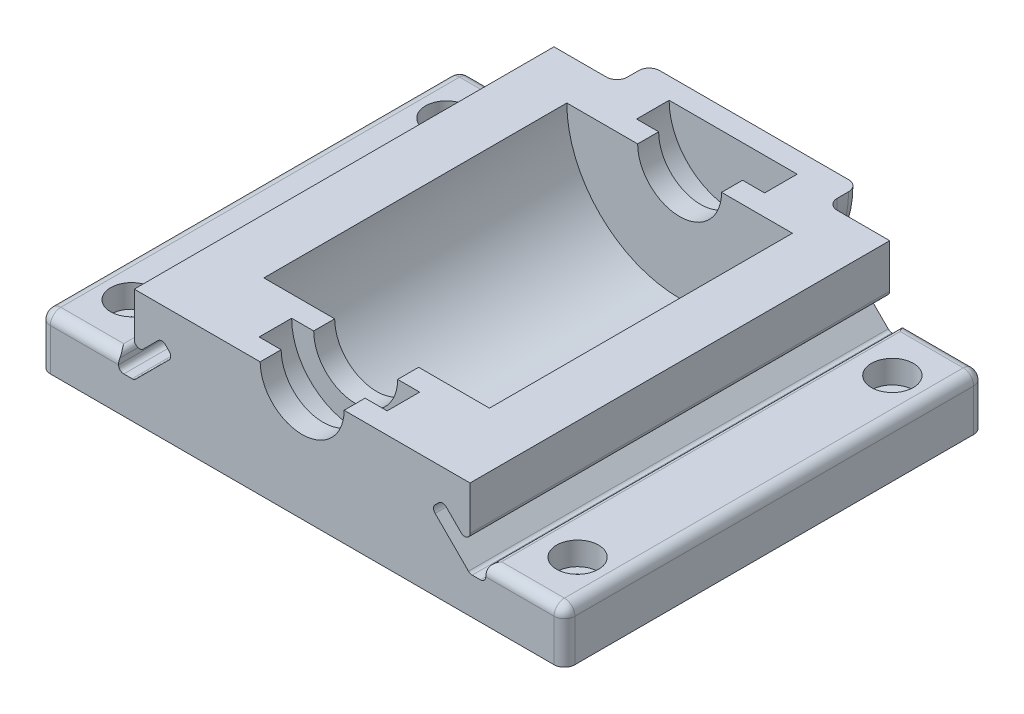
from build123d import *

# Parameters (mm, degrees)
ESQUISSE1_W                                       = 100
ESQUISSE1_H                                       = 80
BOSS_EXTRU_1_DEPTH                                = 10
ESQUISSE2_W                                       = 70
ESQUISSE2_H                                       = 80
BOSS_EXTRU_2_DEPTH                                = 12
BOSS_EXTRU_3_DEPTH                                = 6.15
ESQUISSE3_W                                       = 8
ESQUISSE3_H                                       = 4
CHAMBRAGE_POUR_VIS_SIX_PANS_CREUX_M41_D           = 4.5
CHAMBRAGE_POUR_VIS_SIX_PANS_CREUX_M41_CBORE_D     = 8
CHAMBRAGE_POUR_VIS_SIX_PANS_CREUX_M41_CBORE_DEPTH = 4.4
ENL_V_MAT_EXTRU_1_DEPTH                           = 134.812639538
CONG_1_R                                          = 2


with BuildPart() as part:
    # Esquisse1 → Boss.-Extru.1 (new body)
    with BuildSketch(Plane(origin=(0, 0, 0), x_dir=(1, 0, 0), z_dir=(0, 1, 0))):
        with Locations((-50, 40)):
            Rectangle(ESQUISSE1_W, ESQUISSE1_H)
    extrude(amount=BOSS_EXTRU_1_DEPTH)

    # Esquisse2 → Boss.-Extru.2 (add)
    with BuildSketch(Plane(origin=(0, 10, 0), x_dir=(1, 0, 0), z_dir=(0, 1, 0))):
        with Locations((-50, 40)):
            Rectangle(ESQUISSE2_W, ESQUISSE2_H)
    extrude(amount=BOSS_EXTRU_2_DEPTH)

    # Esquisse7 → Boss.-Extru.3 (add)
    with BuildSketch(Plane(origin=(0, 0, -80), x_dir=(-1, 0, 0), z_dir=(0, 0, -1))):
        with BuildLine():
            Line((70, 22), (30, 22))
            ThreePointArc((30, 22), (50, 2), (70, 22))
        make_face()
    extrude(amount=BOSS_EXTRU_3_DEPTH)

    # Esquisse3 → Enlèvement de matière-Révolution1 (revolve, cut)
    with BuildSketch(Plane(origin=(0, 22, 0), x_dir=(1, 0, 0), z_dir=(0, 1, 0))):
        Polygon((-37.8, 82.15), (-50, 82.15), (-50, 75.95), (-42, 75.95), (-37.8, 75.95), align=None)
        with Locations((-46, 73.95)):
            Rectangle(ESQUISSE3_W, ESQUISSE3_H)
        Polygon((-42, 71.95), (-50, 71.95), (-50, 14.2), (-42, 14.2), (-28.5, 14.2), (-28.5, 71.95), align=None)
        with Locations((-46, 12.2)):
            Rectangle(ESQUISSE3_W, ESQUISSE3_H)
        Polygon((-42, 10.2), (-50, 10.2), (-50, 4), (-42, 4), (-37.8, 4), (-37.8, 10.2), align=None)
        with Locations((-46, 2)):
            Rectangle(ESQUISSE3_W, ESQUISSE3_H)
    revolve(axis=Axis((-50, 22, -86.15), (0, 0, 1)), mode=Mode.SUBTRACT)

    # Chambrage pour vis à six pans creux M41 (through all)
    with Locations(Plane(origin=(-92.5, 10, -70), x_dir=(0, 0, 1), z_dir=(0, 1, 0))):
        with Locations((0, 0), (60, 0), (60, 85), (0, 85)):
            CounterBoreHole(CHAMBRAGE_POUR_VIS_SIX_PANS_CREUX_M41_D / 2, CHAMBRAGE_POUR_VIS_SIX_PANS_CREUX_M41_CBORE_D / 2, CHAMBRAGE_POUR_VIS_SIX_PANS_CREUX_M41_CBORE_DEPTH)

    # Esquisse6 → Enlèv. mat.-Extru.1 (cut, through all)
    with BuildSketch(Plane.XY):
        with BuildLine():
            Line((-15, 22), (-18, 22))
            Line((-18, 22), (-18, 13.656854249))
            ThreePointArc((-18, 13.656854249), (-18.617316568, 12.732974717), (-19.707106781, 12.949747468))
            Line((-19.707106781, 12.949747468), (-22.535533906, 15.778174593))
            ThreePointArc((-22.535533906, 15.778174593), (-23.242640687, 16.071067812), (-23.949747468, 15.778174593))
            Line((-23.949747468, 15.778174593), (-24.656854249, 15.071067812))
            ThreePointArc((-24.656854249, 15.071067812), (-24.949747468, 14.363961031), (-24.656854249, 13.656854249))
            Line((-24.656854249, 13.656854249), (-18.292893219, 7.292893219))
            ThreePointArc((-18.292893219, 7.292893219), (-17.96846987, 7.076120467), (-17.585786438, 7))
            Line((-17.585786438, 7), (-16, 7))
            ThreePointArc((-16, 7), (-15.292893219, 7.292893219), (-15, 8))
            Line((-15, 8), (-15, 9))
            ThreePointArc((-15, 9), (-14.707106781, 9.707106781), (-14, 10))
            Line((-14, 10), (-15, 10))
            Line((-15, 10), (-15, 22))
        make_face()
        with BuildLine():
            Line((-82, 13.656854249), (-82, 22))
            Line((-82, 22), (-85, 22))
            Line((-85, 22), (-85, 10))
            Line((-85, 10), (-86, 10))
            ThreePointArc((-86, 10), (-85.292893219, 9.707106781), (-85, 9))
            Line((-85, 9), (-85, 8))
            ThreePointArc((-85, 8), (-84.707106781, 7.292893219), (-84, 7))
            Line((-84, 7), (-82.414213562, 7))
            ThreePointArc((-82.414213562, 7), (-82.03153013, 7.076120467), (-81.707106781, 7.292893219))
            Line((-81.707106781, 7.292893219), (-75.343145751, 13.656854249))
            ThreePointArc((-75.343145751, 13.656854249), (-75.050252532, 14.363961031), (-75.343145751, 15.071067812))
            Line((-75.343145751, 15.071067812), (-76.050252532, 15.778174593))
            ThreePointArc((-76.050252532, 15.778174593), (-76.757359313, 16.071067812), (-77.464466094, 15.778174593))
            Line((-77.464466094, 15.778174593), (-80.292893219, 12.949747468))
            ThreePointArc((-80.292893219, 12.949747468), (-81.382683432, 12.732974717), (-82, 13.656854249))
        make_face()
    extrude(amount=-ENL_V_MAT_EXTRU_1_DEPTH, mode=Mode.SUBTRACT)

    # Congé1
    # the kernel refuses this fillet: 2 mm, written as the material it adds along each edge
    with BuildSketch(Plane(origin=(-50, 22, -80), x_dir=(1, 0, 0), z_dir=(0, 1, 0))) as cong_1_piece_1:
        with BuildLine():
            CenterArc((20 + CONG_1_R, CONG_1_R), CONG_1_R, 180, 90)
            Line((20, CONG_1_R), (20, 0))
            Line((20, 0), (20 + CONG_1_R, 0))
        make_face()
    revolve(axis=Axis((-50, 22, -80), (0, 0, -1)), revolution_arc=180)
    # the kernel refuses this fillet: 2 mm, written as the material it takes off along each edge
    with BuildSketch(Plane(origin=(-2, 8, -78), x_dir=(0, 1, 0), z_dir=(0, 0, -1))) as cong_1_2_piece_1_section:
        Polygon((0, 0), (CONG_1_R * 1.02, 0), (CONG_1_R * 1.02, CONG_1_R * 1.02), (0, CONG_1_R * 1.02), align=None)
    cong_1_2_piece_1 = extrude(amount=CONG_1_R * 1.02, mode=Mode.PRIVATE)
    cong_1_2_piece_1 = cong_1_2_piece_1 - Plane(origin=(-2, 8, -78), x_dir=(-0.7071067811865475, -0.7071067811865475, 0), z_dir=(0, 0, -1)) * Sphere(CONG_1_R, mode=Mode.PRIVATE)
    add(cong_1_2_piece_1, mode=Mode.SUBTRACT)
    with BuildSketch(Plane(origin=(-98, 8, -78), x_dir=(-1, 0, 0), z_dir=(0, 0, -1))) as cong_1_2_piece_2_section:
        Polygon((0, 0), (CONG_1_R * 1.02, 0), (CONG_1_R * 1.02, CONG_1_R * 1.02), (0, CONG_1_R * 1.02), align=None)
    cong_1_2_piece_2 = extrude(amount=CONG_1_R * 1.02, mode=Mode.PRIVATE)
    cong_1_2_piece_2 = cong_1_2_piece_2 - Plane(origin=(-98, 8, -78), x_dir=(0.7071067811865475, -0.7071067811865475, 0), z_dir=(0, 0, -1)) * Sphere(CONG_1_R, mode=Mode.PRIVATE)
    add(cong_1_2_piece_2, mode=Mode.SUBTRACT)
    with BuildSketch(Plane(origin=(-2, 8, -2), x_dir=(0, 1, 0), z_dir=(0, 0, 1))) as cong_1_2_piece_3_section:
        Polygon((0, 0), (CONG_1_R * 1.02, 0), (CONG_1_R * 1.02, -CONG_1_R * 1.02), (0, -CONG_1_R * 1.02), align=None)
    cong_1_2_piece_3 = extrude(amount=CONG_1_R * 1.02, mode=Mode.PRIVATE)
    cong_1_2_piece_3 = cong_1_2_piece_3 - Plane(origin=(-2, 8, -2), x_dir=(-0.7071067811865475, -0.7071067811865475, 0), z_dir=(0, 0, 1)) * Sphere(CONG_1_R, mode=Mode.PRIVATE)
    add(cong_1_2_piece_3, mode=Mode.SUBTRACT)
    with BuildSketch(Plane(origin=(-98, 8, -2), x_dir=(-1, 0, 0), z_dir=(0, 0, 1))) as cong_1_2_piece_4_section:
        Polygon((0, 0), (CONG_1_R * 1.02, 0), (CONG_1_R * 1.02, -CONG_1_R * 1.02), (0, -CONG_1_R * 1.02), align=None)
    cong_1_2_piece_4 = extrude(amount=CONG_1_R * 1.02, mode=Mode.PRIVATE)
    cong_1_2_piece_4 = cong_1_2_piece_4 - Plane(origin=(-98, 8, -2), x_dir=(0.7071067811865475, -0.7071067811865475, 0), z_dir=(0, 0, 1)) * Sphere(CONG_1_R, mode=Mode.PRIVATE)
    add(cong_1_2_piece_4, mode=Mode.SUBTRACT)
    with BuildSketch(Plane(origin=(0, -5, -80), x_dir=(0, 0, 1), z_dir=(0, 1, 0)), Plane(origin=(0, -5, 0), x_dir=(-1, 0, 0), z_dir=(0, 1, 0))) as cong_1_2_piece_5:
        with BuildLine():
            CenterArc((CONG_1_R, -CONG_1_R), CONG_1_R, 90, 90)
            Line((0, -CONG_1_R), (0, 0))
            Line((0, 0), (CONG_1_R, 0))
        make_face()
    extrude(amount=13, mode=Mode.SUBTRACT)
    with BuildSketch(Plane(origin=(-100, -5, -80), x_dir=(0, 0, 1), z_dir=(0, 1, 0)), Plane(origin=(-100, -5, 0), x_dir=(1, 0, 0), z_dir=(0, 1, 0))) as cong_1_2_piece_6:
        with BuildLine():
            CenterArc((CONG_1_R, CONG_1_R), CONG_1_R, 180, 90)
            Line((0, CONG_1_R), (0, 0))
            Line((0, 0), (CONG_1_R, 0))
        make_face()
    extrude(amount=13, mode=Mode.SUBTRACT)
    with BuildSketch(Plane(origin=(0, 10, -78), x_dir=(-1, 0, 0), z_dir=(0, 0, 1))) as cong_1_2_piece_7:
        with BuildLine():
            CenterArc((CONG_1_R, CONG_1_R), CONG_1_R, 180, 90)
            Line((0, CONG_1_R), (0, 0))
            Line((0, 0), (CONG_1_R, 0))
        make_face()
    extrude(amount=76, mode=Mode.SUBTRACT)
    with BuildSketch(Plane(origin=(-2, 10, 0), x_dir=(0, -1, 0), z_dir=(-1, 0, 0)), Plane(origin=(-81, 10, 0), x_dir=(0, -1, 0), z_dir=(-1, 0, 0))) as cong_1_2_piece_8:
        with BuildLine():
            CenterArc((CONG_1_R, -CONG_1_R), CONG_1_R, 90, 90)
            Line((0, -CONG_1_R), (0, 0))
            Line((0, 0), (CONG_1_R, 0))
        make_face()
    extrude(amount=17, mode=Mode.SUBTRACT)
    with BuildSketch(Plane(origin=(-100, 10, -2), x_dir=(0, -1, 0), z_dir=(0, 0, -1))) as cong_1_2_piece_9:
        with BuildLine():
            CenterArc((CONG_1_R, -CONG_1_R), CONG_1_R, 90, 90)
            Line((0, -CONG_1_R), (0, 0))
            Line((0, 0), (CONG_1_R, 0))
        make_face()
    extrude(amount=76, mode=Mode.SUBTRACT)
    with BuildSketch(Plane(origin=(-19, 10, -80), x_dir=(0, 0, 1), z_dir=(1, 0, 0)), Plane(origin=(-98, 10, -80), x_dir=(0, 0, 1), z_dir=(1, 0, 0))) as cong_1_2_piece_10:
        with BuildLine():
            CenterArc((CONG_1_R, CONG_1_R), CONG_1_R, 180, 90)
            Line((0, CONG_1_R), (0, 0))
            Line((0, 0), (CONG_1_R, 0))
        make_face()
    extrude(amount=17, mode=Mode.SUBTRACT)
    with BuildSketch(Plane(origin=(-50, 22, -86.15), x_dir=(0.9688128753181994, 0.24779348784357297, 0), z_dir=(-0.24779348784357297, 0.9688128753181994, 0))) as cong_1_2_piece_11:
        with BuildLine():
            CenterArc((20 - CONG_1_R, -CONG_1_R), CONG_1_R, 0, 90)
            Line((20 - CONG_1_R, 0), (20, 0))
            Line((20, 0), (20, -CONG_1_R))
        make_face()
    revolve(axis=Axis((-50, 22, -86.15), (0, 0, -1)), revolution_arc=208.69396098, mode=Mode.SUBTRACT)


solid = part.part
